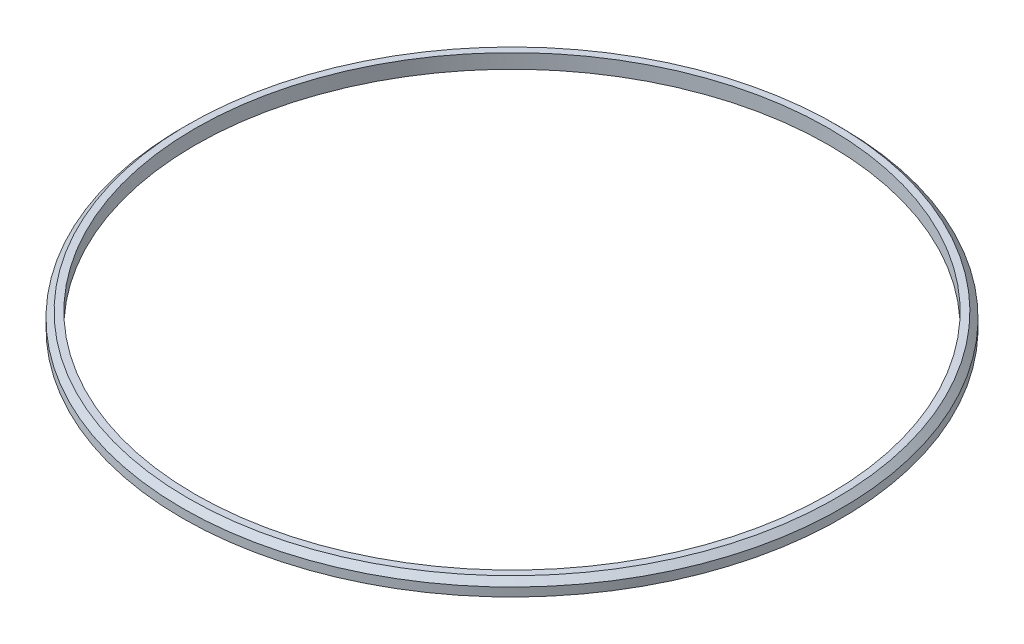
from build123d import *

# Parameters (mm, degrees)
SKETCH1_R           = 57.2
SKETCH1_R_2         = 55
BOSS_EXTRUDE1_DEPTH = 2.5
CHAMFER1_SIZE       = 1


with BuildPart() as part:
    # Sketch1 → Boss-Extrude1 (new body)
    with BuildSketch(Plane(origin=(0, 0, 0), x_dir=(1, 0, 0), z_dir=(0, 1, 0))):
        Circle(SKETCH1_R)
        Circle(SKETCH1_R_2, mode=Mode.SUBTRACT)
    extrude(amount=BOSS_EXTRUDE1_DEPTH)

    # Chamfer1
    chamfer1_edges = [part.edges().sort_by_distance(p)[0] for p in [
        (-57.2, 2.5, 0),
    ]]
    chamfer(chamfer1_edges, length=CHAMFER1_SIZE)


solid = part.part
